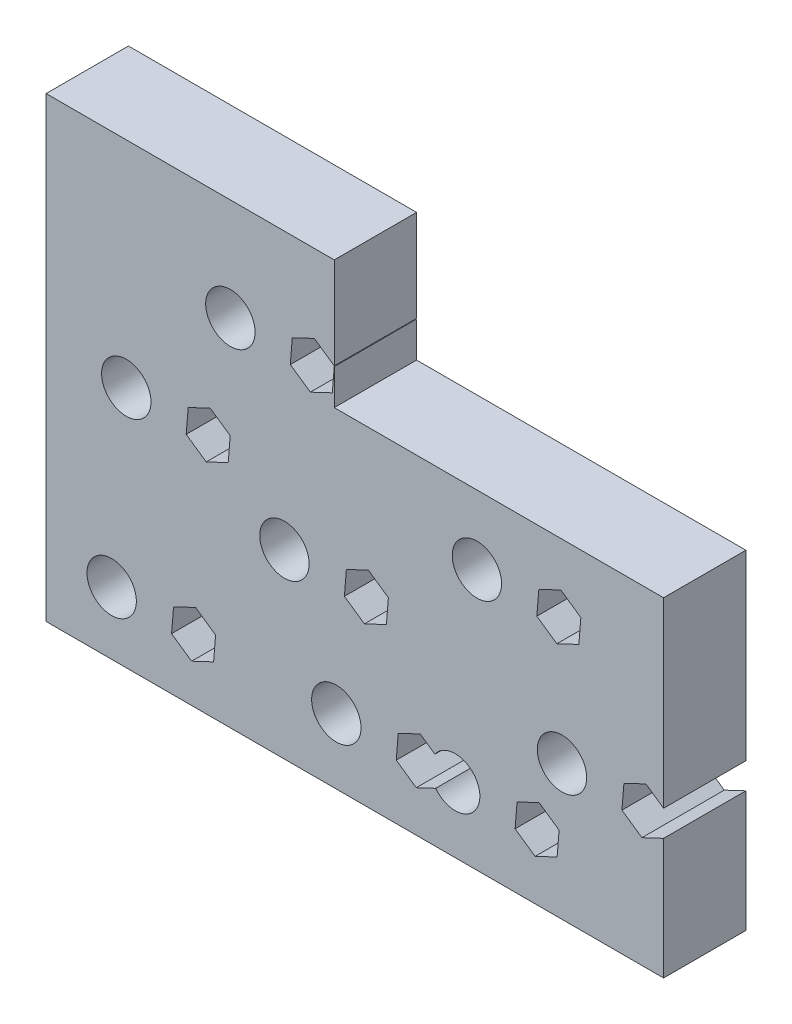
from build123d import *

# Parameters (mm, degrees)
BOSS_EXTRUDE1_DEPTH       = 10
SKETCH2_R                 = 3
CUT_EXTRUDE1_DEPTH        = 10
SKETCH_PATTERN1_OUTLINE_R = 3
SKETCH_PATTERN1_DEPTH     = 10


# Read off the part's stored shape, not the designer's step: Sketch-Pattern1
with BuildPart() as part:
    # Sketch1 → Boss-Extrude1 (new body)
    with BuildSketch(Plane.XY):
        Polygon((0, 0), (75, 0), (75, 40), (35, 40), (35, 55.537974684), (0, 55.537974684), align=None)
    extrude(amount=BOSS_EXTRUDE1_DEPTH)

    # Sketch2 → Cut-Extrude1 (cut)
    with BuildSketch(Plane.XY.offset(10)):
        with Locations((7.962950949, 7.607986586)):
            Circle(SKETCH2_R)
        Polygon((20.345287783, 5.925870596), (20.586453467, 8.872391359), (18.155274475, 10.55450735), (15.482929799, 9.290102577), (15.241764115, 6.343581814), (17.672943107, 4.661465823), align=None)
    extrude(amount=-CUT_EXTRUDE1_DEPTH, mode=Mode.SUBTRACT)

    # Sketch-Pattern1 outline → Sketch-Pattern1 (cut)
    with BuildSketch(Plane.XY):
        with Locations((9.737115818, 29.458094158)):
            Circle(SKETCH_PATTERN1_OUTLINE_R)
        with Locations((52.327690787, 31.62602284)):
            Circle(SKETCH_PATTERN1_OUTLINE_R)
        Polygon((36.229757623, 20.763839411), (38.660936615, 19.08172342), (41.333281291, 20.346128193), (41.574446975, 23.292648956), (39.143267983, 24.974764947), (36.470923307, 23.710360174), align=None)
        with Locations((28.950944457, 22.028244183)):
            Circle(SKETCH_PATTERN1_OUTLINE_R)
        Polygon((35, 44.312366767), (35, 44.387559798), (32.574645536, 46.065645838), (29.90230086, 44.801241065), (29.661135176, 41.854720302), (32.092314168, 40.172604311), (34.764658844, 41.437009084), align=None)
        with Locations((22.38232201, 43.119125074)):
            Circle(SKETCH_PATTERN1_OUTLINE_R)
        Polygon((17.015928983, 28.193689386), (19.447107975, 26.511573395), (22.119452651, 27.775978168), (22.360618335, 30.722498931), (19.929439343, 32.404614922), (17.257094667, 31.140210149), align=None)
        Polygon((59.606503953, 30.361618067), (62.037682945, 28.679502076), (64.710027621, 29.943906849), (64.951193305, 32.890427612), (62.520014313, 34.572543603), (59.847669637, 33.30813883), align=None)
        with Locations((62.661508703, 16.393274831)):
            Circle(SKETCH_PATTERN1_OUTLINE_R)
        Polygon((69.940321868, 15.128870058), (72.37150086, 13.446754067), (75, 14.690413573), (75, 17.854876903), (72.853832228, 19.339795594), (70.181487552, 18.075390822), align=None)
        with Locations((35.250227337, 7.942687663)):
            Circle(SKETCH_PATTERN1_OUTLINE_R)
        Polygon((56.966278334, 6.67828289), (59.397457326, 4.996166899), (62.069802002, 6.260571672), (62.310967686, 9.207092435), (59.879788694, 10.889208426), (57.207444018, 9.624803653), align=None)
        with BuildLine():
            Line((44.960219495, 4.996166899), (47.312866175, 6.109308373))
            ThreePointArc((47.312866175, 6.109308373), (52.686542056, 8.017104238), (47.224860539, 9.656040644))
            Line((47.224860539, 9.656040644), (45.442550863, 10.889208426))
            Line((45.442550863, 10.889208426), (42.770206187, 9.624803653))
            Line((42.770206187, 9.624803653), (42.529040503, 6.67828289))
            Line((42.529040503, 6.67828289), (44.960219495, 4.996166899))
        make_face()
    extrude(amount=SKETCH_PATTERN1_DEPTH, mode=Mode.SUBTRACT)


solid = part.part
